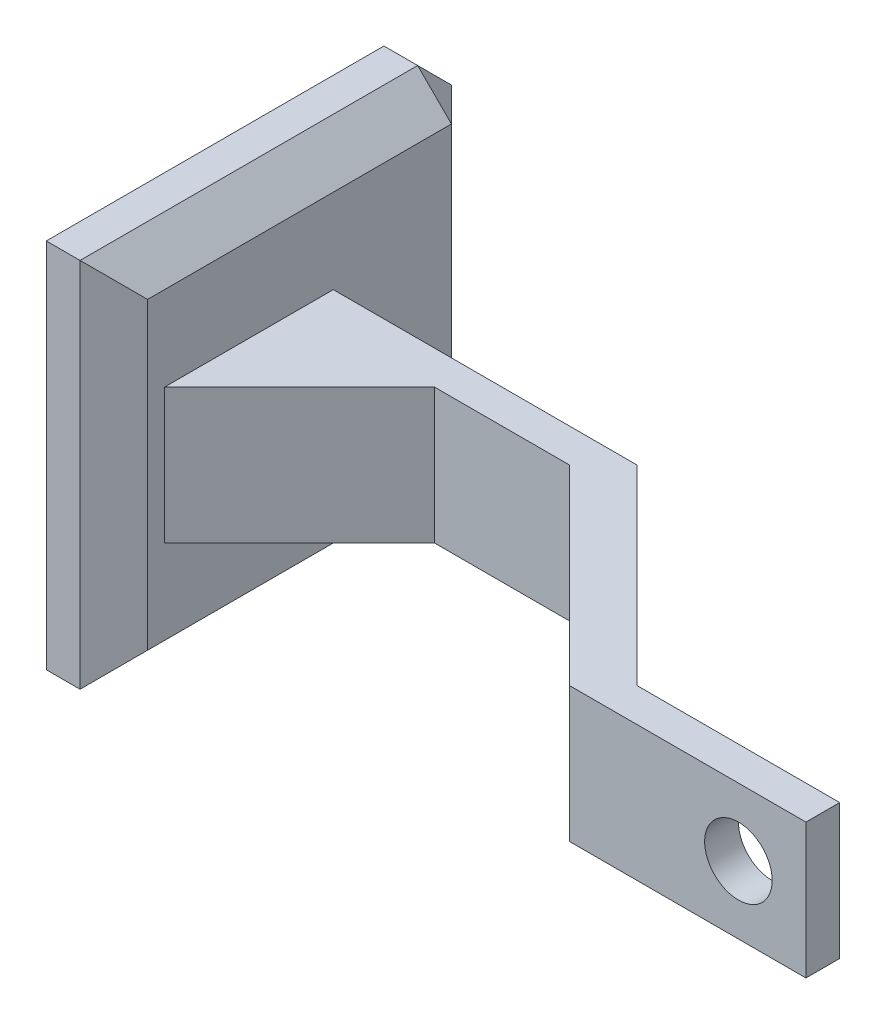
from build123d import *

# Parameters (mm, degrees)
SKETCH1_W           = 20
SKETCH1_H           = 20
SKETCH1_R           = 5
BOSS_EXTRUDE1_DEPTH = 5
SKETCH2_W           = 5
SKETCH2_H           = 20
BOSS_EXTRUDE2_DEPTH = 15
BOSS_EXTRUDE3_DEPTH = 20
SKETCH4_W           = 55
SKETCH4_H           = 55
BOSS_EXTRUDE4_DEPTH = 10
CHAMFER1_SIZE       = 20
SKETCH5_R           = 3.5
BOSS_EXTRUDE5_DEPTH = 10
FILLET1_R           = 2
SKETCH6_W           = 68.516066717
SKETCH6_H           = 1
SKETCH6_W_2         = 60.608861471
CUT_EXTRUDE1_DEPTH  = 10
SKETCH7_R           = 3.5
SKETCH7_R_2         = 3
CUT_EXTRUDE2_DEPTH  = 6
FILLET2_R           = 2
CHAMFER2_SIZE       = 5


# Some blends are built 0.0001 mm under size
with BuildPart() as part:
    # Sketch1 → Boss-Extrude1 (new body)
    with BuildSketch(Plane.XY):
        Rectangle(SKETCH1_W, SKETCH1_H)
        Circle(SKETCH1_R, mode=Mode.SUBTRACT)
    extrude(amount=BOSS_EXTRUDE1_DEPTH)

    # Sketch2 → Boss-Extrude2 (add)
    with BuildSketch(Plane.ZY.offset(10)):
        with Locations((2.5, 0)):
            Rectangle(SKETCH2_W, SKETCH2_H)
    extrude(amount=BOSS_EXTRUDE2_DEPTH)

    # Sketch3 → Boss-Extrude3 (add)
    with BuildSketch(Plane.XZ.offset(10)):
        Polygon((-25, 0), (-25, 5), (-53.284271247, -23.284271247), (-48.284271247, -23.284271247), (-48.284271247, -28.284271247), (-20, 0), align=None)
        Polygon((-48.284271247, -28.284271247), (-53.284271247, -23.284271247), (-93.284271247, -23.284271247), (-93.284271247, -28.284271247), align=None)
        Polygon((-48.284271247, -23.284271247), (-53.284271247, -23.284271247), (-48.284271247, -28.284271247), align=None)
    extrude(amount=-BOSS_EXTRUDE3_DEPTH)

    # Sketch4 → Boss-Extrude4 (add)
    with BuildSketch(Plane.ZY.offset(93.284271247)):
        with Locations((-23.284271247, 0)):
            Rectangle(SKETCH4_W, SKETCH4_H)
    extrude(amount=BOSS_EXTRUDE4_DEPTH)

    # Chamfer1
    chamfer1_edges = [part.edges().sort_by_distance(p)[0] for p in [
        (-93.284271247, 0, -23.284271247),
    ]]
    chamfer(chamfer1_edges, length=CHAMFER1_SIZE)

    # Sketch5 → Boss-Extrude5 (add)
    with BuildSketch(Plane.ZY.offset(103.284271247)):
        with Locations((-37.034271247, -13.75)):
            Circle(SKETCH5_R)
        with Locations((-37.034271247, 13.75)):
            Circle(SKETCH5_R)
        with Locations(Location((-9.534271247, -13.75, 0), (0, 0, 180))):
            Circle(SKETCH5_R)
        with Locations(Location((-9.534271247, 13.75, 0), (0, 0, 180))):
            Circle(SKETCH5_R)
    extrude(amount=BOSS_EXTRUDE5_DEPTH)

    # Fillet1
    fillet1_edges = [part.edges().sort_by_distance(p)[0] for p in [
        (-113.284271247, -13.75, -40.534271247),
        (-113.284271247, 13.75, -40.534271247),
        (-113.284271247, -13.75, -6.034271247),
        (-113.284271247, 13.75, -6.034271247),
    ]]
    fillet(fillet1_edges, radius=FILLET1_R)

    # Sketch6 → Cut-Extrude1 (cut)
    with BuildSketch(Plane.ZY.offset(113.284271247)):
        with Locations((-23.284271248, 13.75)):
            Rectangle(SKETCH6_W, SKETCH6_H)
        with Locations((-23.284271248, -13.75)):
            Rectangle(SKETCH6_W_2, SKETCH6_H)
    extrude(amount=-CUT_EXTRUDE1_DEPTH, mode=Mode.SUBTRACT)

    # Sketch7 → Cut-Extrude2 (cut)
    # profile 1 of 4: a face of its own
    with BuildSketch(Plane.ZY.offset(103.284271247)):
        with Locations((-37.034271247, 13.75)):
            Circle(SKETCH7_R)
        with Locations((-37.034271247, 13.75)):
            Circle(SKETCH7_R_2, mode=Mode.SUBTRACT)
    # profile 2 of 4: a face of its own
    with BuildSketch(Plane.ZY.offset(103.284271247)):
        with Locations((-37.034271247, -13.75)):
            Circle(SKETCH7_R)
        with Locations((-37.034271247, -13.75)):
            Circle(SKETCH7_R_2, mode=Mode.SUBTRACT)
    # profile 3 of 4: a face of its own
    with BuildSketch(Plane.ZY.offset(103.284271247)):
        with Locations((-9.534271247, 13.75)):
            Circle(SKETCH7_R)
        with Locations((-9.534271247, 13.75)):
            Circle(SKETCH7_R_2, mode=Mode.SUBTRACT)
    # profile 4 of 4: a face of its own
    with BuildSketch(Plane.ZY.offset(103.284271247)):
        with Locations((-9.534271247, -13.75)):
            Circle(SKETCH7_R)
        with Locations((-9.534271247, -13.75)):
            Circle(SKETCH7_R_2, mode=Mode.SUBTRACT)
    extrude(amount=CUT_EXTRUDE2_DEPTH, mode=Mode.SUBTRACT)

    # Fillet2
    # the kernel refuses this fillet: 2 mm, written as the material it takes off along each edge
    with BuildSketch(Plane(origin=(-109.284271247, -13.75, -9.534271247), x_dir=(0, -0.7193167459901235, 0.6946822431429928), z_dir=(0, -0.6946822431429928, -0.7193167459901235))) as fillet2_piece_1:
        with BuildLine():
            CenterArc((1.5, 1.322875656), FILLET2_R, 318.590377891, 41.409622109)
            Line((3, 0), (3.03, -0.026457513))
            ThreePointArc((3.03, -0.026457513), (3.25, -0.04), (3.5, -0.04))
            Line((3.5, -0.04), (3.54, 0))
            Line((3.54, 0), (3.54, 1.322875656))
            Line((3.54, 1.322875656), (3.5, 1.322875656))
        make_face()
    revolve(axis=Axis((-109.284271247, -13.75, -9.534271247), (-1, 0, 0)), revolution_arc=271.996196996, mode=Mode.SUBTRACT)
    with BuildSketch(Plane(origin=(-109.284271247, -13.75, -9.534271247), x_dir=(0, 0.7193167459900881, -0.6946822431430294), z_dir=(0, 0.6946822431430294, 0.7193167459900881))) as fillet2_piece_2:
        with BuildLine():
            CenterArc((1.5, 1.322875656), FILLET2_R, 318.590377891, 41.409622109)
            Line((3, 0), (3.03, -0.026457513))
            ThreePointArc((3.03, -0.026457513), (3.25, -0.04), (3.5, -0.04))
            Line((3.5, -0.04), (3.54, 0))
            Line((3.54, 0), (3.54, 1.322875656))
            Line((3.54, 1.322875656), (3.5, 1.322875656))
        make_face()
    revolve(axis=Axis((-109.284271247, -13.75, -9.534271247), (-1, 0, 0)), revolution_arc=271.996196996, mode=Mode.SUBTRACT)
    with BuildSketch(Plane(origin=(-109.284271247, -13.75, -37.034271247), x_dir=(0, 0.7193167459900858, -0.6946822431430317), z_dir=(0, 0.6946822431430317, 0.7193167459900858))) as fillet2_piece_3:
        with BuildLine():
            CenterArc((1.5, 1.322875656), FILLET2_R, 318.590377891, 41.409622109)
            Line((3.5, 1.322875656), (3.54, 1.322875656))
            Line((3.54, 1.322875656), (3.54, 0))
            Line((3.54, 0), (3.5, -0.04))
            ThreePointArc((3.5, -0.04), (3.25, -0.04), (3.03, -0.026457513))
            Line((3.03, -0.026457513), (3, 0))
        make_face()
    revolve(axis=Axis((-109.284271247, -13.75, -37.034271247), (-1, 0, 0)), revolution_arc=271.996196996, mode=Mode.SUBTRACT)
    with BuildSketch(Plane(origin=(-109.284271247, -13.75, -37.034271247), x_dir=(0, -0.7193167459901157, 0.6946822431430008), z_dir=(0, -0.6946822431430008, -0.7193167459901157))) as fillet2_piece_4:
        with BuildLine():
            CenterArc((1.5, 1.322875656), FILLET2_R, 318.590377891, 41.409622109)
            Line((3.5, 1.322875656), (3.54, 1.322875656))
            Line((3.54, 1.322875656), (3.54, 0))
            Line((3.54, 0), (3.5, -0.04))
            ThreePointArc((3.5, -0.04), (3.25, -0.04), (3.03, -0.026457513))
            Line((3.03, -0.026457513), (3, 0))
        make_face()
    revolve(axis=Axis((-109.284271247, -13.75, -37.034271247), (-1, 0, 0)), revolution_arc=271.996196996, mode=Mode.SUBTRACT)
    with BuildSketch(Plane(origin=(-109.284271247, 13.75, -9.534271247), x_dir=(0, -0.7193167459901273, 0.6946822431429889), z_dir=(0, -0.6946822431429889, -0.7193167459901273))) as fillet2_piece_5:
        with BuildLine():
            CenterArc((1.5, 1.322875656), FILLET2_R, 318.590377891, 41.409622109)
            Line((3.5, 1.322875656), (3.54, 1.322875656))
            Line((3.54, 1.322875656), (3.54, 0))
            Line((3.54, 0), (3.5, -0.04))
            ThreePointArc((3.5, -0.04), (3.25, -0.04), (3.03, -0.026457513))
            Line((3.03, -0.026457513), (3, 0))
        make_face()
    revolve(axis=Axis((-109.284271247, 13.75, -9.534271247), (-1, 0, 0)), revolution_arc=271.996196996, mode=Mode.SUBTRACT)
    with BuildSketch(Plane(origin=(-109.284271247, 13.75, -9.534271247), x_dir=(0, 0.7193167459900915, -0.6946822431430258), z_dir=(0, 0.6946822431430258, 0.7193167459900915))) as fillet2_piece_6:
        with BuildLine():
            CenterArc((1.5, 1.322875656), FILLET2_R, 318.590377891, 41.409622109)
            Line((3.5, 1.322875656), (3.54, 1.322875656))
            Line((3.54, 1.322875656), (3.54, 0))
            Line((3.54, 0), (3.5, -0.04))
            ThreePointArc((3.5, -0.04), (3.25, -0.04), (3.03, -0.026457513))
            Line((3.03, -0.026457513), (3, 0))
        make_face()
    revolve(axis=Axis((-109.284271247, 13.75, -9.534271247), (-1, 0, 0)), revolution_arc=271.996196996, mode=Mode.SUBTRACT)
    with BuildSketch(Plane(origin=(-109.284271247, 13.75, -37.034271247), x_dir=(0, -0.7193167459901181, 0.6946822431429984), z_dir=(0, -0.6946822431429984, -0.7193167459901181))) as fillet2_piece_7:
        with BuildLine():
            CenterArc((1.5, 1.322875656), FILLET2_R, 318.590377891, 41.409622109)
            Line((3.5, 1.322875656), (3.54, 1.322875656))
            Line((3.54, 1.322875656), (3.54, 0))
            Line((3.54, 0), (3.5, -0.04))
            ThreePointArc((3.5, -0.04), (3.25, -0.04), (3.03, -0.026457513))
            Line((3.03, -0.026457513), (3, 0))
        make_face()
    revolve(axis=Axis((-109.284271247, 13.75, -37.034271247), (-1, 0, 0)), revolution_arc=271.996196996, mode=Mode.SUBTRACT)
    with BuildSketch(Plane(origin=(-109.284271247, 13.75, -37.034271247), x_dir=(0, 0.7193167459900868, -0.6946822431430307), z_dir=(0, 0.6946822431430307, 0.7193167459900868))) as fillet2_piece_8:
        with BuildLine():
            CenterArc((1.5, 1.322875656), FILLET2_R, 318.590377891, 41.409622109)
            Line((3.5, 1.322875656), (3.54, 1.322875656))
            Line((3.54, 1.322875656), (3.54, 0))
            Line((3.54, 0), (3.5, -0.04))
            ThreePointArc((3.5, -0.04), (3.25, -0.04), (3.03, -0.026457513))
            Line((3.03, -0.026457513), (3, 0))
        make_face()
    revolve(axis=Axis((-109.284271247, 13.75, -37.034271247), (-1, 0, 0)), revolution_arc=271.996196996, mode=Mode.SUBTRACT)

    # Chamfer2
    chamfer2_edges = [part.edges().sort_by_distance(p)[0] for p in [
        (-93.284271247, 0, -50.784271247),
        (-98.284271247, 27.5, -50.784271247),
        (-93.284271247, -27.5, -23.284271247),
        (-98.284271247, -27.5, -50.784271247),
        (-93.284271247, 0, 4.215728753),
        (-93.284271247, 27.5, -23.284271247),
        (-103.284271247, 0, -50.784271247),
    ]]
    chamfer(chamfer2_edges, length=CHAMFER2_SIZE - 0.0001)  # a hair under: the kernel refuses the full size


solid = part.part
